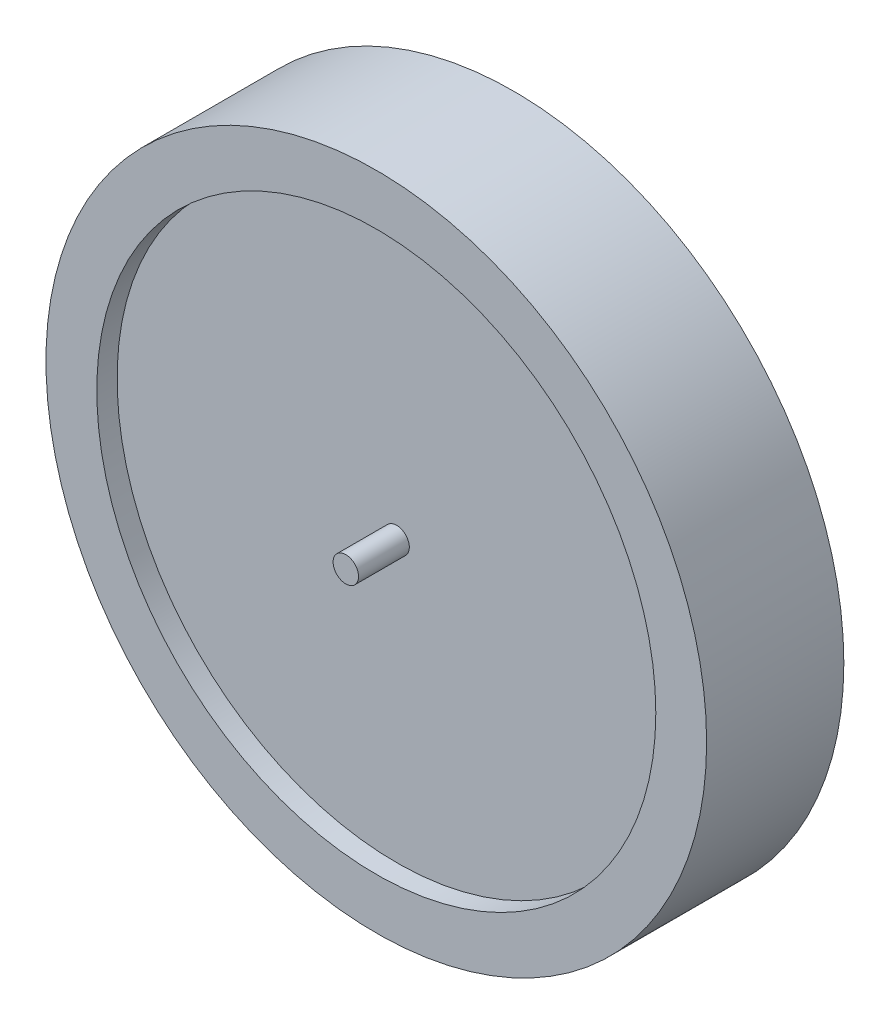
from build123d import *

# Parameters (mm, degrees)
SKETCH1_R                = 65
BOSS_EXTRUDE1_DEPTH      = 27
SKETCH3_R                = 55
CUT_EXTRUDE1_DEPTH       = 4
CUT_EXTRUDE2_START       = -4
SKETCH4_R                = 55
CUT_EXTRUDE2_DEPTH       = 4
BOSS_EXTRUDE2_DEPTH      = 10
BOSS_EXTRUDE2_DEPTH_BACK = 30
SKETCH5_R                = 2.5


with BuildPart() as part:
    # Sketch1 → Boss-Extrude1 (new body)
    with BuildSketch(Plane.XY):
        Circle(SKETCH1_R)
    extrude(amount=BOSS_EXTRUDE1_DEPTH)

    # Sketch3 → Cut-Extrude1 (cut)
    with BuildSketch(Plane.XY.offset(27)):
        Circle(SKETCH3_R)
    extrude(amount=-CUT_EXTRUDE1_DEPTH, mode=Mode.SUBTRACT)

    # Sketch4 → Cut-Extrude2 (cut)
    with BuildSketch(Plane(origin=(0, 0, 0), x_dir=(-1, 0, 0), z_dir=(0, 0, -1)).offset(CUT_EXTRUDE2_START)):
        Circle(SKETCH4_R)
    extrude(amount=CUT_EXTRUDE2_DEPTH, mode=Mode.SUBTRACT)

    # Sketch5 → Boss-Extrude2 (add, two sides: drawn at the far end of the back side and taken through both)
    with BuildSketch(Plane.XY.offset(23).offset(-BOSS_EXTRUDE2_DEPTH_BACK)):
        Circle(SKETCH5_R)
    extrude(amount=BOSS_EXTRUDE2_DEPTH + BOSS_EXTRUDE2_DEPTH_BACK)


solid = part.part
